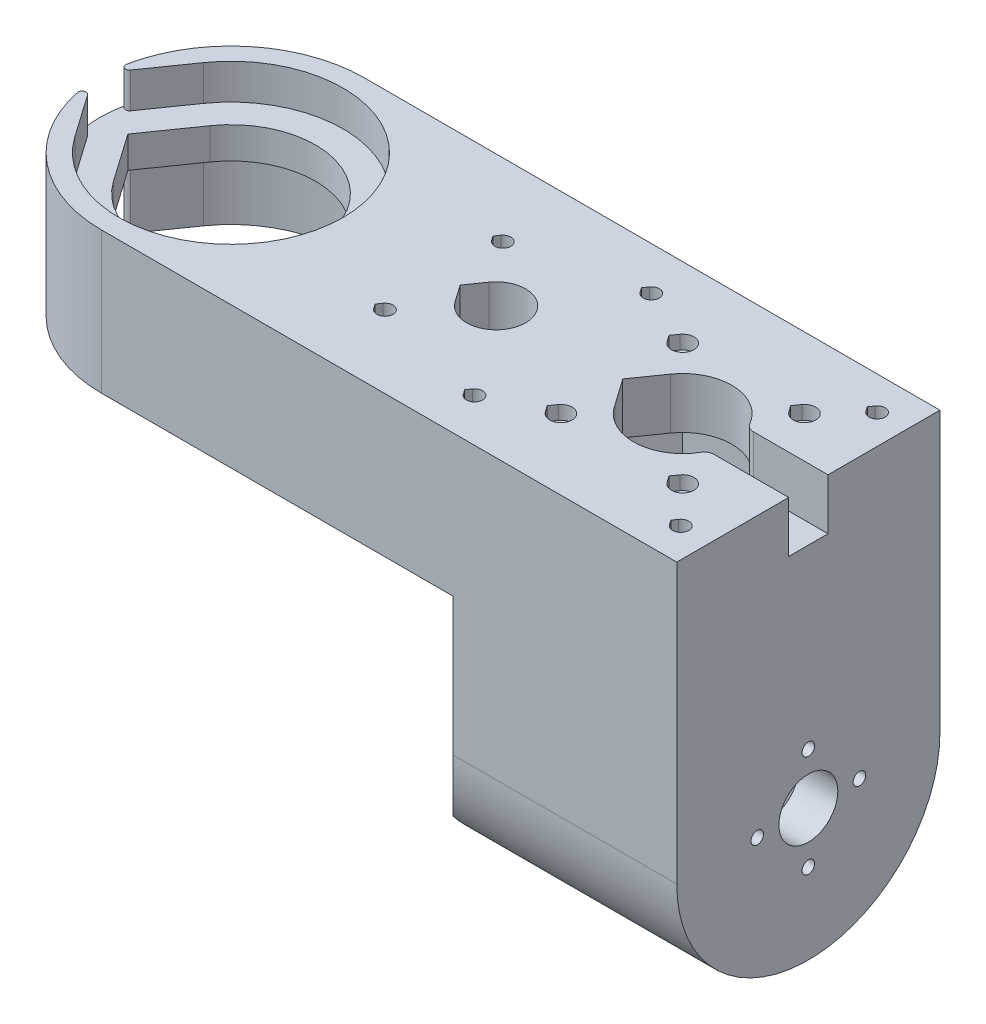
from build123d import *
from OCP.BRepFilletAPI import BRepFilletAPI_MakeChamfer

# Parameters (mm, degrees)
BOSS_EXTRUDE1_DEPTH     = 67
CUT_EXTRUDE1_DEPTH      = 199.010732032
CUT_EXTRUDE1_DEPTH_BACK = 199.010732032
FILLET3_R               = 34
CUT_EXTRUDE2_DEPTH      = 199.010732032
CUT_EXTRUDE2_DEPTH_BACK = 10
CUT_EXTRUDE3_START      = -10
CUT_EXTRUDE3_DEPTH      = 9
CUT_EXTRUDE4_START      = -27
CUT_EXTRUDE4_DEPTH      = 19
CUT_EXTRUDE5_DEPTH      = 13
CUT_EXTRUDE6_DEPTH      = 3.5
CUT_EXTRUDE7_DEPTH      = 10
CUT_EXTRUDE8_DEPTH      = 7
CUT_EXTRUDE18_REACH     = 200.011
CUT_EXTRUDE24_START     = -10
CUT_EXTRUDE24_DEPTH     = 10
CUT_EXTRUDE25_DEPTH     = 5
CUT_EXTRUDE26_DEPTH     = 20
CUT_EXTRUDE27_START     = -10
CUT_EXTRUDE27_DEPTH     = 7
CUT_EXTRUDE28_START     = -5
CUT_EXTRUDE28_DEPTH     = 7
CUT_EXTRUDE29_DEPTH     = 176.471507659
FILLET1_R               = 5
FILLET2_R               = 2.5
FILLET4_R               = 1
CHAMFER7_SIZE           = 12
SKETCH11_R              = 1.6
CUT_EXTRUDE19_DEPTH     = 201.29726975
SKETCH11_3_R            = 2.85
CUT_EXTRUDE20_DEPTH     = 3.5
CHAMFER6_SIZE           = 7
CUT_EXTRUDE16_REACH     = 210.875
CHAMFER8_SIZE           = 5
CHAMFER8_SIZE2          = 3.535533906
CUT_EXTRUDE21_START     = -10
CUT_EXTRUDE21_DEPTH     = 10
SKETCH13_R              = 5
CUT_EXTRUDE22_DEPTH     = 10
FILLET6_R               = 5
CUT_EXTRUDE23_START     = -10
CUT_EXTRUDE23_DEPTH     = 10
CUT_EXTRUDE30_DEPTH     = 7
CUT_EXTRUDE31_DEPTH     = 15
CHAMFER11_SIZE          = 4.33
SKETCH17_R              = 7.5
CUT_EXTRUDE32_DEPTH     = 10


with BuildPart() as part:
    # Sketch1 → Boss-Extrude1 (new body)
    with BuildSketch(Plane(origin=(0, 0, 0), x_dir=(0, 1, 0), z_dir=(0, 0, 1))):
        Polygon((35, 33.5), (35, -83), (-33.5, -83), (-33.5, -147), (81, -147), (81, 33.5), align=None)
    extrude(amount=BOSS_EXTRUDE1_DEPTH)

    # Sketch2 → Cut-Extrude1 (cut, two sides: drawn at the far end of the back side and taken through both)
    with BuildSketch(Plane(origin=(0, 81, 0), x_dir=(-1, 0, 0), z_dir=(0, 1, 0)).offset(-CUT_EXTRUDE1_DEPTH_BACK)):
        with BuildLine():
            Line((17.611768952, 21.168106618), (26.246653658, 33.5))
            Line((26.246653658, 33.5), (17.611768952, 45.831893382))
            ThreePointArc((17.611768952, 45.831893382), (-21.5, 33.5), (17.611768952, 21.168106618))
        make_face()
    extrude(amount=CUT_EXTRUDE1_DEPTH + CUT_EXTRUDE1_DEPTH_BACK, mode=Mode.SUBTRACT)

    # Fillet3
    # the kernel refuses this fillet: 34 mm, written as the material it takes off along each edge
    with BuildSketch(Plane(origin=(-33.5, 166, 0), x_dir=(0, 0, 1), z_dir=(0, -1, 0))) as fillet3_piece_1:
        with BuildLine():
            CenterArc((FILLET3_R, -FILLET3_R), FILLET3_R, 90, 90)
            Line((0, -FILLET3_R), (0, 0))
            Line((0, 0), (FILLET3_R, 0))
        make_face()
    extrude(amount=216, mode=Mode.SUBTRACT)
    with BuildSketch(Plane(origin=(-33.5, 166, 67), x_dir=(0, 0, -1), z_dir=(0, -1, 0))) as fillet3_piece_2:
        with BuildLine():
            CenterArc((FILLET3_R, FILLET3_R), FILLET3_R, 180, 90)
            Line((0, FILLET3_R), (0, 0))
            Line((0, 0), (FILLET3_R, 0))
        make_face()
    extrude(amount=216, mode=Mode.SUBTRACT)

    # Sketch2<4> → Cut-Extrude2 (cut, two sides: drawn at the far end of the back side and taken through both)
    with BuildSketch(Plane(origin=(0, 81, 0), x_dir=(-1, 0, 0), z_dir=(0, 1, 0)).offset(-CUT_EXTRUDE2_DEPTH_BACK)):
        with BuildLine():
            Line((-147, 16), (-147, 51))
            Line((-147, 51), (-135.082575695, 51))
            ThreePointArc((-135.082575695, 51), (-130.5, 54), (-125.917424305, 51))
            Line((-125.917424305, 51), (-104.082575695, 51))
            ThreePointArc((-104.082575695, 51), (-99.5, 54), (-94.917424305, 51))
            Line((-94.917424305, 51), (-66.071067812, 51))
            ThreePointArc((-66.071067812, 51), (-62.535533906, 52.464466094), (-61.071067812, 56))
            Line((-61.071067812, 56), (-61.071067812, 67))
            Line((-61.071067812, 67), (-21.857492994, 67))
            Line((-21.857492994, 67), (33.5, 67))
            Line((33.5, 67), (33.5, 0))
            Line((33.5, 0), (-21.857492994, 0))
            Line((-21.857492994, 0), (-61.071067812, 0))
            Line((-61.071067812, 0), (-61.071067812, 11))
            ThreePointArc((-61.071067812, 11), (-62.535533906, 14.535533906), (-66.071067812, 16))
            Line((-66.071067812, 16), (-94.917424305, 16))
            ThreePointArc((-94.917424305, 16), (-99.5, 13), (-104.082575695, 16))
            Line((-104.082575695, 16), (-125.917424305, 16))
            ThreePointArc((-125.917424305, 16), (-130.5, 13), (-135.082575695, 16))
            Line((-135.082575695, 16), (-147, 16))
        make_face()
    extrude(amount=CUT_EXTRUDE2_DEPTH + CUT_EXTRUDE2_DEPTH_BACK, mode=Mode.SUBTRACT)

    # Sketch2<5> → Cut-Extrude3 (cut)
    with BuildSketch(Plane(origin=(0, 81, 0), x_dir=(-1, 0, 0), z_dir=(0, 1, 0)).offset(CUT_EXTRUDE3_START)):
        with BuildLine():
            Line((23.386790864, 17.124392742), (34.853114509, 33.5))
            Line((34.853114509, 33.5), (23.386790864, 49.875607258))
            ThreePointArc((23.386790864, 49.875607258), (-28.55, 33.5), (23.386790864, 17.124392742))
        make_face()
    extrude(amount=-CUT_EXTRUDE3_DEPTH, mode=Mode.SUBTRACT)

    # Sketch2<6> → Cut-Extrude4 (cut)
    with BuildSketch(Plane(origin=(0, 81, 0), x_dir=(-1, 0, 0), z_dir=(0, 1, 0)).offset(CUT_EXTRUDE4_START)):
        with BuildLine():
            Line((23.386790864, 17.124392742), (34.853114509, 33.5))
            Line((34.853114509, 33.5), (23.386790864, 49.875607258))
            ThreePointArc((23.386790864, 49.875607258), (-28.55, 33.5), (23.386790864, 17.124392742))
        make_face()
    extrude(amount=-CUT_EXTRUDE4_DEPTH, mode=Mode.SUBTRACT)

    # Sketch3 → Cut-Extrude5 (cut)
    with BuildSketch(Plane(origin=(0, 71, 0), x_dir=(-1, 0, 0), z_dir=(0, 1, 0))):
        with BuildLine():
            Line((-99.74031764, 33.5), (-104.333810411, 40.01785238))
            ThreePointArc((-104.333810411, 40.01785238), (-115.855624093, 45.970681914), (-126.456439237, 38.5))
            Line((-126.456439237, 38.5), (-147, 38.5))
            Line((-147, 38.5), (-147, 28.5))
            Line((-147, 28.5), (-126.456439237, 28.5))
            ThreePointArc((-126.456439237, 28.5), (-116.243865439, 21.062042018), (-104.760599446, 26.330294546))
            Line((-104.760599446, 26.330294546), (-99.74031764, 33.5))
        make_face()
        with BuildLine():
            Line((-129.22, 49.96), (-128.5, 49))
            Line((-128.5, 49), (-129.22, 48.04))
            ThreePointArc((-129.22, 48.04), (-132.1, 49), (-129.22, 49.96))
        make_face()
        with BuildLine():
            Line((-98.22, 48.04), (-97.5, 49))
            Line((-97.5, 49), (-98.22, 49.96))
            ThreePointArc((-98.22, 49.96), (-101.1, 49), (-98.22, 48.04))
        make_face()
        with BuildLine():
            Line((-98.22, 17.04), (-97.5, 18))
            Line((-97.5, 18), (-98.22, 18.96))
            ThreePointArc((-98.22, 18.96), (-101.1, 18), (-98.22, 17.04))
        make_face()
        with BuildLine():
            Line((-129.22, 17.04), (-128.5, 18))
            Line((-128.5, 18), (-129.22, 18.96))
            ThreePointArc((-129.22, 18.96), (-132.1, 18), (-129.22, 17.04))
        make_face()
    extrude(amount=-CUT_EXTRUDE5_DEPTH, mode=Mode.SUBTRACT)

    # Sketch3<3> → Cut-Extrude6 (cut)
    with BuildSketch(Plane(origin=(0, 71, 0), x_dir=(-1, 0, 0), z_dir=(0, 1, 0))):
        with BuildLine():
            Line((-128.179285714, 50.654323186), (-127, 49))
            Line((-127, 49), (-128.179285714, 47.345676814))
            ThreePointArc((-128.179285714, 47.345676814), (-133.35, 49), (-128.179285714, 50.654323186))
        make_face()
        with BuildLine():
            Line((-96, 49), (-97.179285714, 47.345676814))
            ThreePointArc((-97.179285714, 47.345676814), (-102.35, 49), (-97.179285714, 50.654323186))
            Line((-97.179285714, 50.654323186), (-96, 49))
        make_face()
        with BuildLine():
            Line((-96, 18), (-97.179285714, 16.345676814))
            ThreePointArc((-97.179285714, 16.345676814), (-102.35, 18), (-97.179285714, 19.654323186))
            Line((-97.179285714, 19.654323186), (-96, 18))
        make_face()
        with BuildLine():
            Line((-127, 18), (-128.179285714, 16.345676814))
            ThreePointArc((-128.179285714, 16.345676814), (-133.35, 18), (-128.179285714, 19.654323186))
            Line((-128.179285714, 19.654323186), (-127, 18))
        make_face()
    extrude(amount=-CUT_EXTRUDE6_DEPTH, mode=Mode.SUBTRACT)

    # Sketch4 → Cut-Extrude7 (cut)
    with BuildSketch(Plane(origin=(0, 71, 0), x_dir=(-1, 0, 0), z_dir=(0, 1, 0))):
        with BuildLine():
            Line((-52.889356729, 49.417722298), (-52.246760658, 48.5))
            Line((-52.246760658, 48.5), (-52.889356729, 47.582277702))
            ThreePointArc((-52.889356729, 47.582277702), (-55.8, 48.5), (-52.889356729, 49.417722298))
        make_face()
        with BuildLine():
            Line((-52.889356729, 19.417722298), (-52.246760658, 18.5))
            Line((-52.246760658, 18.5), (-52.889356729, 17.582277702))
            ThreePointArc((-52.889356729, 17.582277702), (-55.8, 18.5), (-52.889356729, 19.417722298))
        make_face()
    extrude(amount=-CUT_EXTRUDE7_DEPTH, mode=Mode.SUBTRACT)

    # Sketch4<3> → Cut-Extrude8 (cut)
    # profile 1 of 2: a face of its own
    with BuildSketch(Plane(origin=(0, 71, 0), x_dir=(-1, 0, 0), z_dir=(0, 1, 0))):
        with BuildLine():
            Line((-51.697412093, 48.5), (-52.520738309, 47.324168305))
            ThreePointArc((-52.520738309, 47.324168305), (-56.25, 48.5), (-52.520738309, 49.675831695))
            Line((-52.520738309, 49.675831695), (-51.697412093, 48.5))
        make_face()
        with BuildLine():
            Line((-52.889356729, 49.417722298), (-52.246760658, 48.5))
            Line((-52.246760658, 48.5), (-52.889356729, 47.582277702))
            ThreePointArc((-52.889356729, 47.582277702), (-55.8, 48.5), (-52.889356729, 49.417722298))
        make_face(mode=Mode.SUBTRACT)
    # profile 2 of 2: a face of its own
    with BuildSketch(Plane(origin=(0, 71, 0), x_dir=(-1, 0, 0), z_dir=(0, 1, 0))):
        with BuildLine():
            Line((-51.697412093, 18.5), (-52.520738309, 17.324168305))
            ThreePointArc((-52.520738309, 17.324168305), (-56.25, 18.5), (-52.520738309, 19.675831695))
            Line((-52.520738309, 19.675831695), (-51.697412093, 18.5))
        make_face()
        with BuildLine():
            Line((-52.889356729, 19.417722298), (-52.246760658, 18.5))
            Line((-52.246760658, 18.5), (-52.889356729, 17.582277702))
            ThreePointArc((-52.889356729, 17.582277702), (-55.8, 18.5), (-52.889356729, 19.417722298))
        make_face(mode=Mode.SUBTRACT)
    extrude(amount=-CUT_EXTRUDE8_DEPTH, mode=Mode.SUBTRACT)

    # Cut-Extrude18: up to this face of the body (flat: up to its plane)
    cut_extrude18_end = Plane(part.part.faces().sort_by_distance((120.971111033, 58, 33.49934117))[0])
    # Sketch10 → Cut-Extrude18 (cut, up to the picked face)
    with BuildSketch(Plane.XZ.offset(33.5), mode=Mode.PRIVATE) as cut_extrude18_sk1:
        Polygon((93, 55.5), (137, 55.5), (137, 11.5), (93, 11.5), (93, 23.5), (83, 23.5), (83, 43.5), (93, 43.5), align=None)
    cut_extrude18_tool1 = split(extrude(cut_extrude18_sk1.sketch, amount=-CUT_EXTRUDE18_REACH, mode=Mode.PRIVATE), bisect_by=cut_extrude18_end, keep=Keep.BOTH, mode=Mode.PRIVATE)
    add(cut_extrude18_tool1.solids().sort_by(Axis((112.47191, -33.5, 33.5), (0, 1, 0)))[0], mode=Mode.SUBTRACT)

    # Sketch6 → Cut-Extrude24 (cut)
    with BuildSketch(Plane.XZ.offset(-35).offset(CUT_EXTRUDE24_START)):
        with BuildLine():
            Line((59.431732852, 23.5), (83, 23.5))
            Line((83, 23.5), (83, 43.5))
            Line((83, 43.5), (59.431732852, 43.5))
            Line((59.431732852, 43.5), (59.431732852, 51.534248627))
            Line((59.431732852, 51.534248627), (22.132970349, 51.534248627))
            ThreePointArc((22.132970349, 51.534248627), (28.383056062, 30.417042236), (17.744736277, 11.134248627))
            Line((17.744736277, 11.134248627), (59.431732852, 11.134248627))
            Line((59.431732852, 11.134248627), (59.431732852, 23.5))
        make_face()
        with BuildLine():
            ThreePointArc((61.356359668, 37.801823273), (75, 33.5), (61.356359668, 29.198176727))
            Line((61.356359668, 29.198176727), (58.344190584, 33.5))
            Line((58.344190584, 33.5), (61.356359668, 37.801823273))
        make_face(mode=Mode.SUBTRACT)
    extrude(amount=CUT_EXTRUDE24_DEPTH, mode=Mode.SUBTRACT)

    # Sketch6<8> → Cut-Extrude25 (cut)
    with BuildSketch(Plane.XZ.offset(-35)):
        Polygon((59.431732852, 55.865751373), (59.431732852, 43.5), (75, 43.5), (83, 43.5), (83, 55.865751373), align=None)
        Polygon((75, 23.5), (59.431732852, 23.5), (59.431732852, 11.134248627), (83, 11.134248627), (83, 23.5), align=None)
    extrude(amount=-CUT_EXTRUDE25_DEPTH, mode=Mode.SUBTRACT)

    # Sketch6<9> → Cut-Extrude26 (cut)
    with BuildSketch(Plane.XZ.offset(-35)):
        with BuildLine():
            Line((38.121089582, 15.416526329), (37.47849351, 16.334248627))
            Line((37.47849351, 16.334248627), (38.121089582, 17.251970925))
            ThreePointArc((38.121089582, 17.251970925), (41.031732852, 16.334248627), (38.121089582, 15.416526329))
        make_face()
        with BuildLine():
            Line((38.121089582, 45.416526329), (37.47849351, 46.334248627))
            Line((37.47849351, 46.334248627), (38.121089582, 47.251970925))
            ThreePointArc((38.121089582, 47.251970925), (41.031732852, 46.334248627), (38.121089582, 45.416526329))
        make_face()
        with BuildLine():
            Line((73.689356729, 49.417722298), (73.046760658, 48.5))
            Line((73.046760658, 48.5), (73.689356729, 47.582277702))
            ThreePointArc((73.689356729, 47.582277702), (76.6, 48.5), (73.689356729, 49.417722298))
        make_face()
        with BuildLine():
            Line((73.689356729, 17.582277702), (73.046760658, 18.5))
            Line((73.046760658, 18.5), (73.689356729, 19.417722298))
            ThreePointArc((73.689356729, 19.417722298), (76.6, 18.5), (73.689356729, 17.582277702))
        make_face()
    extrude(amount=-CUT_EXTRUDE26_DEPTH, mode=Mode.SUBTRACT)

    # Sketch6<10> → Cut-Extrude27 (cut)
    with BuildSketch(Plane.XZ.offset(-35).offset(CUT_EXTRUDE27_START)):
        with BuildLine():
            Line((36.929144946, 16.334248627), (37.752471162, 17.510080322))
            ThreePointArc((37.752471162, 17.510080322), (41.481732852, 16.334248627), (37.752471162, 15.158416933))
            Line((37.752471162, 15.158416933), (36.929144946, 16.334248627))
        make_face()
        with BuildLine():
            Line((36.929144946, 46.334248627), (37.752471162, 47.510080322))
            ThreePointArc((37.752471162, 47.510080322), (41.481732852, 46.334248627), (37.752471162, 45.158416933))
            Line((37.752471162, 45.158416933), (36.929144946, 46.334248627))
        make_face()
    extrude(amount=-CUT_EXTRUDE27_DEPTH, mode=Mode.SUBTRACT)

    # Sketch6<13> → Cut-Extrude28 (cut)
    with BuildSketch(Plane.XZ.offset(-35).offset(CUT_EXTRUDE28_START)):
        with BuildLine():
            Line((72.497412093, 48.5), (73.320738309, 49.675831695))
            ThreePointArc((73.320738309, 49.675831695), (77.05, 48.5), (73.320738309, 47.324168305))
            Line((73.320738309, 47.324168305), (72.497412093, 48.5))
        make_face()
        with BuildLine():
            Line((73.320738309, 17.324168305), (72.497412093, 18.5))
            Line((72.497412093, 18.5), (73.320738309, 19.675831695))
            ThreePointArc((73.320738309, 19.675831695), (77.05, 18.5), (73.320738309, 17.324168305))
        make_face()
    extrude(amount=-CUT_EXTRUDE28_DEPTH, mode=Mode.SUBTRACT)

    # Sketch6<14> → Cut-Extrude29 (cut, through all)
    with BuildSketch(Plane.XZ.offset(-35)):
        with BuildLine():
            ThreePointArc((61.356359668, 29.198176727), (75, 33.5), (61.356359668, 37.801823273))
            Line((61.356359668, 37.801823273), (58.344190584, 33.5))
            Line((58.344190584, 33.5), (61.356359668, 29.198176727))
        make_face()
    extrude(amount=-CUT_EXTRUDE29_DEPTH, mode=Mode.SUBTRACT)

    # Fillet1
    fillet1_edges = [part.edges().sort_by_distance(p)[0] for p in [
        (61.071067812, 76, 0),
        (61.071067812, 76, 67),
    ]]
    fillet(fillet1_edges, radius=FILLET1_R)

    # Fillet2
    fillet2_edges = [part.edges().sort_by_distance(p)[0] for p in [
        (126.456439237, 64.5, 38.5),
        (126.456439237, 64.5, 28.5),
        (135.082575695, 76, 16),
        (135.082575695, 76, 51),
        (125.917424305, 76, 51),
        (104.082575695, 76, 51),
        (94.917424305, 76, 51),
        (94.917424305, 76, 16),
        (104.082575695, 76, 16),
        (125.917424305, 76, 16),
    ]]
    fillet(fillet2_edges, radius=FILLET2_R)

    # Fillet4
    fillet4_edges = [part.edges().sort_by_distance(p)[0] for p in [
        (-33.402614008, 66.5, 35.5715294),
        (-33.402614008, 66.5, 31.4284706),
        (-33.402614008, 44.5, 35.5715294),
        (-33.402614008, 44.5, 31.4284706),
    ]]
    fillet(fillet4_edges, radius=FILLET4_R)

    # Chamfer7
    # the kernel refuses this chamfer: 12 mm, written as the material it takes off along each edge
    with BuildSketch(Plane(origin=(93, -64.360195856, 43.5), x_dir=(0.02749587661058678, 0, 0.9996219169112968), z_dir=(0, 1, 0))) as chamfer7_piece_1_section:
        Polygon((CHAMFER7_SIZE * 0.999621916911, -CHAMFER7_SIZE * 0.0274958766106), (-CHAMFER7_SIZE * 0.0274958766106, -CHAMFER7_SIZE * 0.999621916911), (0, 0), align=None)
    chamfer7_piece_1 = extrude(amount=122.360195856, mode=Mode.PRIVATE)
    chamfer7_piece_1 = split(chamfer7_piece_1, bisect_by=Plane(origin=(83, 3.25, 52.5), z_dir=(1, 0, 0)), keep=Keep.TOP, mode=Mode.PRIVATE)
    add(chamfer7_piece_1, mode=Mode.SUBTRACT)
    with BuildSketch(Plane(origin=(93, -64.360195856, 43.5), x_dir=(0.02749587661058678, 0, 0.9996219169112968), z_dir=(0, 1, 0))) as chamfer7_piece_2_section:
        Polygon((CHAMFER7_SIZE * 0.999621916911, -CHAMFER7_SIZE * 0.0274958766106), (-CHAMFER7_SIZE * 0.0274958766106, -CHAMFER7_SIZE * 0.999621916911), (0, 0), align=None)
    chamfer7_piece_2 = extrude(amount=153.220391711, mode=Mode.PRIVATE)
    chamfer7_piece_2 = split(chamfer7_piece_2, bisect_by=Plane(origin=(82.333333333, 45, 44.166666667), z_dir=(0, -1, 0)), keep=Keep.TOP, mode=Mode.PRIVATE)
    add(chamfer7_piece_2, mode=Mode.SUBTRACT)
    with BuildSketch(Plane(origin=(93, -64.360195856, 23.5), x_dir=(-0.9996219169112968, 0, 0.02749587661058648), z_dir=(0, 1, 0))) as chamfer7_piece_3_section:
        Polygon((CHAMFER7_SIZE * 0.999621916911, -CHAMFER7_SIZE * 0.0274958766106), (-CHAMFER7_SIZE * 0.0274958766106, -CHAMFER7_SIZE * 0.999621916911), (0, 0), align=None)
    chamfer7_piece_3 = extrude(amount=122.360195856, mode=Mode.PRIVATE)
    chamfer7_piece_3 = split(chamfer7_piece_3, bisect_by=Plane(origin=(83, 3.25, 20.234168406), z_dir=(1, 0, 0)), keep=Keep.TOP, mode=Mode.PRIVATE)
    add(chamfer7_piece_3, mode=Mode.SUBTRACT)
    with BuildSketch(Plane(origin=(93, -64.360195856, 23.5), x_dir=(-0.9996219169112968, 0, 0.02749587661058648), z_dir=(0, 1, 0))) as chamfer7_piece_4_section:
        Polygon((CHAMFER7_SIZE * 0.999621916911, -CHAMFER7_SIZE * 0.0274958766106), (-CHAMFER7_SIZE * 0.0274958766106, -CHAMFER7_SIZE * 0.999621916911), (0, 0), align=None)
    chamfer7_piece_4 = extrude(amount=153.220391711, mode=Mode.PRIVATE)
    chamfer7_piece_4 = split(chamfer7_piece_4, bisect_by=Plane(origin=(82.333333333, 45, 22.833333333), z_dir=(0, -1, 0)), keep=Keep.TOP, mode=Mode.PRIVATE)
    add(chamfer7_piece_4, mode=Mode.SUBTRACT)

    # Sketch11 → Cut-Extrude19 (cut, through all)
    with BuildSketch(Plane(origin=(137, 0, 0), x_dir=(0, -1, 0), z_dir=(-1, 0, 0))):
        with Locations((0, 46.5)):
            Circle(SKETCH11_R)
        with Locations((13, 33.5)):
            Circle(SKETCH11_R)
        with Locations((0, 20.5)):
            Circle(SKETCH11_R)
        with Locations((-13, 33.5)):
            Circle(SKETCH11_R)
    extrude(amount=-CUT_EXTRUDE19_DEPTH, mode=Mode.SUBTRACT)

    # Sketch11<3> → Cut-Extrude20 (cut)
    with BuildSketch(Plane(origin=(137, 0, 0), x_dir=(0, -1, 0), z_dir=(-1, 0, 0))):
        with Locations((0, 46.5)):
            Circle(SKETCH11_3_R)
        with Locations((13, 33.5)):
            Circle(SKETCH11_3_R)
        with Locations((0, 20.5)):
            Circle(SKETCH11_3_R)
        with Locations((-13, 33.5)):
            Circle(SKETCH11_3_R)
    extrude(amount=-CUT_EXTRUDE20_DEPTH, mode=Mode.SUBTRACT)

    # Chamfer6
    chamfer6_edges = [part.edges().sort_by_distance(p)[0] for p in [
        (83, 0.75, 0),
        (83, 0.75, 67),
    ]]
    chamfer(chamfer6_edges, length=CHAMFER6_SIZE)

    # Cut-Extrude16: up to this face of the body (flat: up to its plane)
    cut_extrude16_end = Plane(part.part.faces().sort_by_distance((83, 2.57254859, 52.647484775))[0])
    # Sketch9 → Cut-Extrude16 (cut, up to the picked face)
    with BuildSketch(Plane.YZ.offset(147), mode=Mode.PRIVATE) as cut_extrude16_sk1:
        with BuildLine():
            Line((0, 67), (-54.532381669, 67))
            Line((-54.532381669, 67), (-54.532381669, 0))
            Line((-54.532381669, 0), (0, 0))
            ThreePointArc((0, 0), (-33.5, 33.5), (0, 67))
        make_face()
    cut_extrude16_tool1 = split(extrude(cut_extrude16_sk1.sketch, amount=-CUT_EXTRUDE16_REACH, mode=Mode.PRIVATE), bisect_by=cut_extrude16_end, keep=Keep.BOTH, mode=Mode.PRIVATE)
    add(cut_extrude16_tool1.solids().sort_by(Axis((147, -39.431118, 33.5), (-1, 0, 0)))[0], mode=Mode.SUBTRACT)

    # Chamfer8: one chamfer whose edges measure the first distance from different faces: ONE call of the kernel's chamfer builder (chamfer() names one face for all edges)
    chamfer8_edges_1 = [part.edges().sort_by_distance(p)[0] for p in [
        (83, 4.361505827, 45.5),
    ]]
    chamfer8_side_1 = [part.faces().sort_by_distance(p)[0] for p in [
        (87.874881653, 14.965824505, 50.374881653),
    ]]
    chamfer8_edges_2 = [part.edges().sort_by_distance(p)[0] for p in [
        (83, 4.361505827, 21.5),
    ]]
    chamfer8_side_2 = [part.faces().sort_by_distance(p)[0] for p in [
        (87.874881653, 14.965824505, 16.625118347),
    ]]
    chamfer8 = BRepFilletAPI_MakeChamfer(part.part.solid().wrapped)
    for e in chamfer8_edges_1:
        chamfer8.Add(CHAMFER8_SIZE, CHAMFER8_SIZE2, e.wrapped, chamfer8_side_1[0].wrapped)  # the first distance lies on this face
    for e in chamfer8_edges_2:
        chamfer8.Add(CHAMFER8_SIZE, CHAMFER8_SIZE2, e.wrapped, chamfer8_side_2[0].wrapped)  # the first distance lies on this face
    add(Compound.cast(chamfer8.Shape()), mode=Mode.REPLACE)

    # Sketch12 → Cut-Extrude21 (cut)
    with BuildSketch(Plane(origin=(83, 0, 0), x_dir=(0, -1, 0), z_dir=(-1, 0, 0)).offset(CUT_EXTRUDE21_START)):
        with BuildLine():
            Line((25.263610193, 55.5), (25.263610193, 11.5))
            ThreePointArc((25.263610193, 11.5), (33.5, 33.5), (25.263610193, 55.5))
        make_face()
    extrude(amount=CUT_EXTRUDE21_DEPTH, mode=Mode.SUBTRACT)

    # Sketch13 → Cut-Extrude22 (cut)
    with BuildSketch(Plane(origin=(83, 0, 0), x_dir=(0, -1, 0), z_dir=(-1, 0, 0))):
        with Locations((0, 46.5)):
            Circle(SKETCH13_R)
        with Locations((0, 20.5)):
            Circle(SKETCH13_R)
    extrude(amount=-CUT_EXTRUDE22_DEPTH, mode=Mode.SUBTRACT)

    # Fillet6
    fillet6_edges = [part.edges().sort_by_distance(p)[0] for p in [
        (84.767766953, -4.30941618, 17.964466094),
        (84.767766953, 4.30941618, 17.964466094),
        (84.767766953, 4.30941618, 49.035533906),
        (84.767766953, -4.30941618, 49.035533906),
    ]]
    fillet(fillet6_edges, radius=FILLET6_R)

    # Sketch14 → Cut-Extrude23 (cut)
    with BuildSketch(Plane(origin=(0, 81, 0), x_dir=(-1, 0, 0), z_dir=(0, 1, 0)).offset(CUT_EXTRUDE23_START)):
        with BuildLine():
            Line((-66.071067812, 16), (-93.5, 16))
            ThreePointArc((-93.5, 16), (-94.618033989, 15.736067977), (-95.5, 15))
            ThreePointArc((-95.5, 15), (-99.5, 13), (-103.5, 15))
            ThreePointArc((-103.5, 15), (-104.381966011, 15.736067977), (-105.5, 16))
            Line((-105.5, 16), (-124.5, 16))
            ThreePointArc((-124.5, 16), (-125.618033989, 15.736067977), (-126.5, 15))
            ThreePointArc((-126.5, 15), (-130.5, 13), (-134.5, 15))
            ThreePointArc((-134.5, 15), (-135.381966011, 15.736067977), (-136.5, 16))
            Line((-136.5, 16), (-147, 16))
            Line((-147, 16), (-147, 0))
            Line((-147, 0), (-66.071067812, 0))
            ThreePointArc((-66.071067812, 0), (-62.535533906, 1.464466094), (-61.071067812, 5))
            Line((-61.071067812, 5), (-61.071067812, 11))
            ThreePointArc((-61.071067812, 11), (-62.535533906, 14.535533906), (-66.071067812, 16))
        make_face()
        with BuildLine():
            Line((-93.5, 51), (-66.071067812, 51))
            ThreePointArc((-66.071067812, 51), (-62.535533906, 52.464466094), (-61.071067812, 56))
            Line((-61.071067812, 56), (-61.071067812, 62))
            ThreePointArc((-61.071067812, 62), (-62.535533906, 65.535533906), (-66.071067812, 67))
            Line((-66.071067812, 67), (-147, 67))
            Line((-147, 67), (-147, 51))
            Line((-147, 51), (-136.5, 51))
            ThreePointArc((-136.5, 51), (-135.381966011, 51.263932023), (-134.5, 52))
            ThreePointArc((-134.5, 52), (-130.5, 54), (-126.5, 52))
            ThreePointArc((-126.5, 52), (-125.618033989, 51.263932023), (-124.5, 51))
            Line((-124.5, 51), (-105.5, 51))
            ThreePointArc((-105.5, 51), (-104.381966011, 51.263932023), (-103.5, 52))
            ThreePointArc((-103.5, 52), (-99.5, 54), (-95.5, 52))
            ThreePointArc((-95.5, 52), (-94.618033989, 51.263932023), (-93.5, 51))
        make_face()
    extrude(amount=CUT_EXTRUDE23_DEPTH, mode=Mode.SUBTRACT)

    # Sketch16 → Cut-Extrude30 (cut)
    # profile 1 of 4: a face of its own
    with BuildSketch(Plane(origin=(0, 71, 0), x_dir=(-1, 0, 0), z_dir=(0, 1, 0))):
        with BuildLine():
            Line((-81.997412093, 11), (-82.820738309, 9.824168305))
            ThreePointArc((-82.820738309, 9.824168305), (-86.55, 11), (-82.820738309, 12.175831695))
            Line((-82.820738309, 12.175831695), (-81.997412093, 11))
        make_face()
        with BuildLine():
            Line((-83.189356729, 10.082277702), (-82.546760658, 11))
            Line((-82.546760658, 11), (-83.189356729, 11.917722298))
            ThreePointArc((-83.189356729, 11.917722298), (-86.1, 11), (-83.189356729, 10.082277702))
        make_face(mode=Mode.SUBTRACT)
    # profile 2 of 4: a face of its own
    with BuildSketch(Plane(origin=(0, 71, 0), x_dir=(-1, 0, 0), z_dir=(0, 1, 0))):
        with BuildLine():
            Line((-136.997412093, 8.5), (-137.820738309, 7.324168305))
            ThreePointArc((-137.820738309, 7.324168305), (-141.55, 8.5), (-137.820738309, 9.675831695))
            Line((-137.820738309, 9.675831695), (-136.997412093, 8.5))
        make_face()
        with BuildLine():
            Line((-138.189356729, 7.582277702), (-137.546760658, 8.5))
            Line((-137.546760658, 8.5), (-138.189356729, 9.417722298))
            ThreePointArc((-138.189356729, 9.417722298), (-141.1, 8.5), (-138.189356729, 7.582277702))
        make_face(mode=Mode.SUBTRACT)
    # profile 3 of 4: a face of its own
    with BuildSketch(Plane(origin=(0, 71, 0), x_dir=(-1, 0, 0), z_dir=(0, 1, 0))):
        with BuildLine():
            Line((-136.997412093, 58.5), (-137.820738309, 57.324168305))
            ThreePointArc((-137.820738309, 57.324168305), (-141.55, 58.5), (-137.820738309, 59.675831695))
            Line((-137.820738309, 59.675831695), (-136.997412093, 58.5))
        make_face()
        with BuildLine():
            Line((-138.189356729, 57.582277702), (-137.546760658, 58.5))
            Line((-137.546760658, 58.5), (-138.189356729, 59.417722298))
            ThreePointArc((-138.189356729, 59.417722298), (-141.1, 58.5), (-138.189356729, 57.582277702))
        make_face(mode=Mode.SUBTRACT)
    # profile 4 of 4: a face of its own
    with BuildSketch(Plane(origin=(0, 71, 0), x_dir=(-1, 0, 0), z_dir=(0, 1, 0))):
        with BuildLine():
            Line((-81.997412093, 56), (-82.820738309, 54.824168305))
            ThreePointArc((-82.820738309, 54.824168305), (-86.55, 56), (-82.820738309, 57.175831695))
            Line((-82.820738309, 57.175831695), (-81.997412093, 56))
        make_face()
        with BuildLine():
            Line((-83.189356729, 55.082277702), (-82.546760658, 56))
            Line((-82.546760658, 56), (-83.189356729, 56.917722298))
            ThreePointArc((-83.189356729, 56.917722298), (-86.1, 56), (-83.189356729, 55.082277702))
        make_face(mode=Mode.SUBTRACT)
    extrude(amount=-CUT_EXTRUDE30_DEPTH, mode=Mode.SUBTRACT)

    # Sketch16<2> → Cut-Extrude31 (cut)
    with BuildSketch(Plane(origin=(0, 71, 0), x_dir=(-1, 0, 0), z_dir=(0, 1, 0))):
        with BuildLine():
            Line((-138.189356729, 59.417722298), (-137.546760658, 58.5))
            Line((-137.546760658, 58.5), (-138.189356729, 57.582277702))
            ThreePointArc((-138.189356729, 57.582277702), (-141.1, 58.5), (-138.189356729, 59.417722298))
        make_face()
        with BuildLine():
            Line((-138.189356729, 9.417722298), (-137.546760658, 8.5))
            Line((-137.546760658, 8.5), (-138.189356729, 7.582277702))
            ThreePointArc((-138.189356729, 7.582277702), (-141.1, 8.5), (-138.189356729, 9.417722298))
        make_face()
        with BuildLine():
            Line((-83.189356729, 11.917722298), (-82.546760658, 11))
            Line((-82.546760658, 11), (-83.189356729, 10.082277702))
            ThreePointArc((-83.189356729, 10.082277702), (-86.1, 11), (-83.189356729, 11.917722298))
        make_face()
        with BuildLine():
            Line((-83.189356729, 56.917722298), (-82.546760658, 56))
            Line((-82.546760658, 56), (-83.189356729, 55.082277702))
            ThreePointArc((-83.189356729, 55.082277702), (-86.1, 56), (-83.189356729, 56.917722298))
        make_face()
    extrude(amount=-CUT_EXTRUDE31_DEPTH, mode=Mode.SUBTRACT)

    # Chamfer11
    chamfer11_edges = [part.edges().sort_by_distance(p)[0] for p in [
        (59.431732852, 37.5, 51.534248627),
    ]]
    chamfer(chamfer11_edges, length=CHAMFER11_SIZE)

    # Sketch17 → Cut-Extrude32 (cut)
    with BuildSketch(Plane.YZ.offset(147)):
        with Locations(Location((0, 33.5, 0), (0, 0, 270))):
            Circle(SKETCH17_R)
    extrude(amount=-CUT_EXTRUDE32_DEPTH, mode=Mode.SUBTRACT)


solid = part.part
